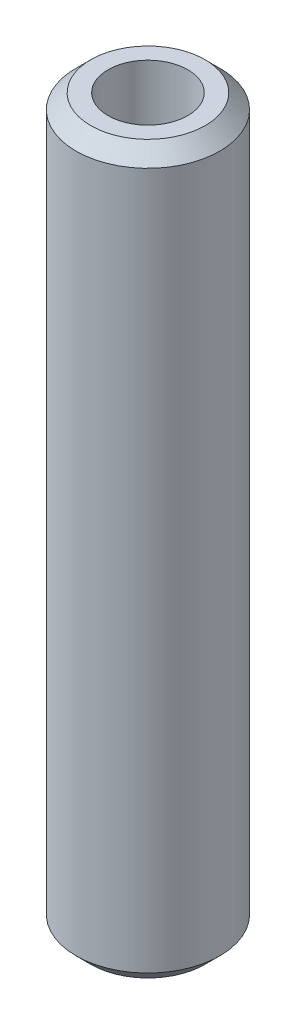
from build123d import *

# Parameters (mm, degrees)
SKETCH1_R           = 17.5
BOSS_EXTRUDE1_DEPTH = 176.837730406
SKETCH2_R           = 9.697694773
CUT_EXTRUDE1_DEPTH  = 179.561146096
CHAMFER1_SIZE       = 3.580366434


with BuildPart() as part:
    # Sketch1 → Boss-Extrude1 (new body)
    with BuildSketch(Plane(origin=(0, 0, 0), x_dir=(1, 0, 0), z_dir=(0, 1, 0))):
        Circle(SKETCH1_R)
    extrude(amount=BOSS_EXTRUDE1_DEPTH)

    # Sketch2 → Cut-Extrude1 (cut, through all)
    with BuildSketch(Plane(origin=(0, 0, 0), x_dir=(1, 0, 0), z_dir=(0, 1, 0))):
        Circle(SKETCH2_R)
    extrude(amount=CUT_EXTRUDE1_DEPTH, mode=Mode.SUBTRACT)

    # Chamfer1
    chamfer1_edges = [part.edges().sort_by_distance(p)[0] for p in [
        (-17.5, 176.837730406, 0),
        (-17.5, 0, 0),
    ]]
    chamfer(chamfer1_edges, length=CHAMFER1_SIZE)


solid = part.part
